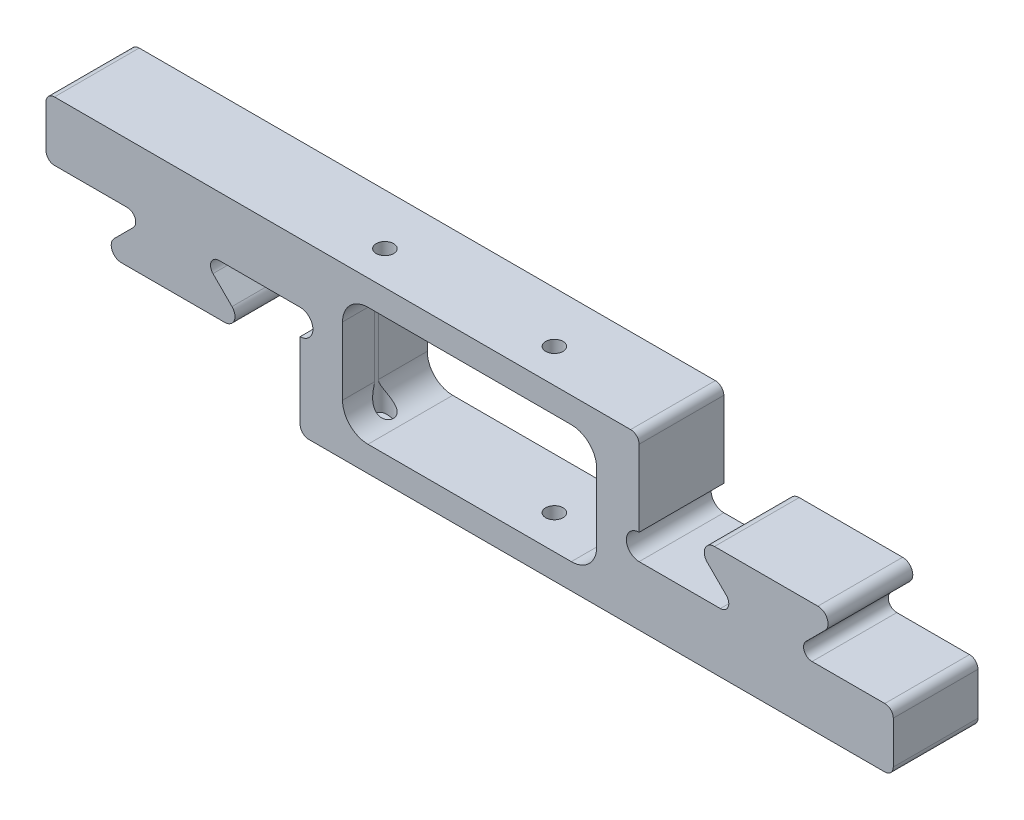
from build123d import *

# Parameters (mm, degrees)
ABS_ZWING_MIRRORED_START      = -10
ABS_ZWING_MIRRORED_DEPTH      = 10
ABS_ZWING_MIRRORED_START_2    = -1.5
ABS_ZWING_MIRRORED_2_DEPTH    = 1.5
SKETCH1_W                     = 30
SKETCH1_H                     = 14
CUT_EXTRUDE1_DEPTH            = 10
FILLET1_R                     = 3
BOSS_EXTRUDE2_DEPTH           = 8.5
CUT_EXTRUDE2_DEPTH            = 10
TAP_DRILL_FOR_M2_5_TAP1_D     = 2.05
TAP_DRILL_FOR_M2_5_TAP1_DEPTH = 30.5


# Read off the part's stored shape, not the designer's step: abs_zwing_Mirrored
with BuildPart() as part:
    # abs_zwing_Mirrored outline → abs_zwing_Mirrored (new body)
    with BuildSketch(Plane.XY.offset(ABS_ZWING_MIRRORED_START)):
        with BuildLine():
            ThreePointArc((-23.5, 2.5), (-22, 1), (-23.5, -0.5))
            Line((-23.5, -0.5), (-23.5, -9.5))
            ThreePointArc((-23.5, -9.5), (-23.207106781, -10.207106781), (-22.5, -10.5))
            Line((-22.5, -10.5), (45.5, -10.5))
            ThreePointArc((45.5, -10.5), (46.207106781, -10.207106781), (46.5, -9.5))
            Line((46.5, -9.5), (46.5, -4.5))
            ThreePointArc((46.5, -4.5), (46.207106781, -3.792893219), (45.5, -3.5))
            Line((45.5, -3.5), (36.914213562, -3.5))
            ThreePointArc((36.914213562, -3.5), (35.99033403, -2.882683432), (36.207106781, -1.792893219))
            Line((36.207106781, -1.792893219), (38.792893219, 0.792893219))
            ThreePointArc((38.792893219, 0.792893219), (39.00966597, 1.882683432), (38.085786438, 2.5))
            Line((38.085786438, 2.5), (24.914213562, 2.5))
            ThreePointArc((24.914213562, 2.5), (23.99033403, 1.882683432), (24.207106781, 0.792893219))
            Line((24.207106781, 0.792893219), (26.792893219, -1.792893219))
            ThreePointArc((26.792893219, -1.792893219), (27.00966597, -2.882683432), (26.085786438, -3.5))
            Line((26.085786438, -3.5), (16.5, -3.5))
            ThreePointArc((16.5, -3.5), (15, -2), (16.5, -0.5))
            Line((16.5, -0.5), (16.5, 8.5))
            ThreePointArc((16.5, 8.5), (16.207106781, 9.207106781), (15.5, 9.5))
            Line((15.5, 9.5), (-52.5, 9.5))
            ThreePointArc((-52.5, 9.5), (-53.207106781, 9.207106781), (-53.5, 8.5))
            Line((-53.5, 8.5), (-53.5, 3.5))
            ThreePointArc((-53.5, 3.5), (-53.207106781, 2.792893219), (-52.5, 2.5))
            Line((-52.5, 2.5), (-43.914213562, 2.5))
            ThreePointArc((-43.914213562, 2.5), (-42.99033403, 1.882683432), (-43.207106781, 0.792893219))
            Line((-43.207106781, 0.792893219), (-45.792893219, -1.792893219))
            ThreePointArc((-45.792893219, -1.792893219), (-46.00966597, -2.882683432), (-45.085786438, -3.5))
            Line((-45.085786438, -3.5), (-31.914213562, -3.5))
            ThreePointArc((-31.914213562, -3.5), (-30.99033403, -2.882683432), (-31.207106781, -1.792893219))
            Line((-31.207106781, -1.792893219), (-33.792893219, 0.792893219))
            ThreePointArc((-33.792893219, 0.792893219), (-34.00966597, 1.882683432), (-33.085786438, 2.5))
            Line((-33.085786438, 2.5), (-23.5, 2.5))
        make_face()
        with BuildLine():
            ThreePointArc((-22, -1.598076211), (-20.602222521, 1.776457136), (-23.5, 4))
            Line((-23.5, 4), (-33.085786438, 4))
            ThreePointArc((-33.085786438, 4), (-35.395485269, 2.456708581), (-34.853553391, -0.267766953))
            Line((-34.853553391, -0.267766953), (-33.121320344, -2))
            Line((-33.121320344, -2), (-43.878679656, -2))
            Line((-43.878679656, -2), (-42.146446609, -0.267766953))
            ThreePointArc((-42.146446609, -0.267766953), (-41.604514731, 2.456708581), (-43.914213562, 4))
            Line((-43.914213562, 4), (-52, 4))
            Line((-52, 4), (-52, 8))
            Line((-52, 8), (15, 8))
            Line((15, 8), (15, 0.598076211))
            ThreePointArc((15, 0.598076211), (13.602222521, -2.776457136), (16.5, -5))
            Line((16.5, -5), (26.085786438, -5))
            ThreePointArc((26.085786438, -5), (28.395485269, -3.456708581), (27.853553391, -0.732233047))
            Line((27.853553391, -0.732233047), (26.121320344, 1))
            Line((26.121320344, 1), (36.878679656, 1))
            Line((36.878679656, 1), (35.146446609, -0.732233047))
            ThreePointArc((35.146446609, -0.732233047), (34.604514731, -3.456708581), (36.914213562, -5))
            Line((36.914213562, -5), (45, -5))
            Line((45, -5), (45, -9))
            Line((45, -9), (-22, -9))
            Line((-22, -9), (-22, -1.598076211))
        make_face(mode=Mode.SUBTRACT)
    extrude(amount=ABS_ZWING_MIRRORED_DEPTH)

    # abs_zwing_Mirrored 2 outline → abs_zwing_Mirrored 2 (add)
    with BuildSketch(Plane.XY.offset(ABS_ZWING_MIRRORED_START_2)):
        with BuildLine():
            Line((-33.085786438, 4), (-23.5, 4))
            ThreePointArc((-23.5, 4), (-20.602222521, 1.776457136), (-22, -1.598076211))
            Line((-22, -1.598076211), (-22, -9))
            Line((-22, -9), (45, -9))
            Line((45, -9), (45, -5))
            Line((45, -5), (36.914213562, -5))
            ThreePointArc((36.914213562, -5), (34.604514731, -3.456708581), (35.146446609, -0.732233047))
            Line((35.146446609, -0.732233047), (36.878679656, 1))
            Line((36.878679656, 1), (26.121320344, 1))
            Line((26.121320344, 1), (27.853553391, -0.732233047))
            ThreePointArc((27.853553391, -0.732233047), (28.395485269, -3.456708581), (26.085786438, -5))
            Line((26.085786438, -5), (16.5, -5))
            ThreePointArc((16.5, -5), (13.602222521, -2.776457136), (15, 0.598076211))
            Line((15, 0.598076211), (15, 8))
            Line((15, 8), (-52, 8))
            Line((-52, 8), (-52, 4))
            Line((-52, 4), (-43.914213562, 4))
            ThreePointArc((-43.914213562, 4), (-41.604514731, 2.456708581), (-42.146446609, -0.267766953))
            Line((-42.146446609, -0.267766953), (-43.878679656, -2))
            Line((-43.878679656, -2), (-33.121320344, -2))
            Line((-33.121320344, -2), (-34.853553391, -0.267766953))
            ThreePointArc((-34.853553391, -0.267766953), (-35.395485269, 2.456708581), (-33.085786438, 4))
        make_face()
    extrude(amount=ABS_ZWING_MIRRORED_2_DEPTH)

    # Sketch1 → Cut-Extrude1 (cut)
    with BuildSketch(Plane(origin=(0, 0, -1.5), x_dir=(-1, 0, 0), z_dir=(0, 0, -1))):
        with Locations((3.5, -0.5)):
            Rectangle(SKETCH1_W, SKETCH1_H)
    extrude(amount=-CUT_EXTRUDE1_DEPTH, mode=Mode.SUBTRACT)

    # Fillet1
    fillet1_edges = [part.edges().sort_by_distance(p)[0] for p in [
        (11.5, -7.5, -0.75),
        (11.5, 6.5, -0.75),
        (-18.5, 6.5, -0.75),
        (-18.5, -7.5, -0.75),
    ]]
    fillet(fillet1_edges, radius=FILLET1_R)

    # Sketch4 → Boss-Extrude2 (add)
    with BuildSketch(Plane(origin=(0, 0, -1.5), x_dir=(-1, 0, 0), z_dir=(0, 0, -1))):
        with BuildLine():
            Line((-13, 3.5), (-13, -4.5))
            ThreePointArc((-13, -4.5), (-11.681980515, -7.681980515), (-8.5, -9))
            Line((-8.5, -9), (15.5, -9))
            ThreePointArc((15.5, -9), (18.681980515, -7.681980515), (20, -4.5))
            Line((20, -4.5), (20, 3.5))
            ThreePointArc((20, 3.5), (18.681980515, 6.681980515), (15.5, 8))
            Line((15.5, 8), (-8.5, 8))
            ThreePointArc((-8.5, 8), (-11.681980515, 6.681980515), (-13, 3.5))
        make_face()
        with BuildLine():
            Line((-11.5, 3.5), (-11.5, -4.5))
            ThreePointArc((-11.5, -4.5), (-10.621320344, -6.621320344), (-8.5, -7.5))
            Line((-8.5, -7.5), (15.5, -7.5))
            ThreePointArc((15.5, -7.5), (17.621320344, -6.621320344), (18.5, -4.5))
            Line((18.5, -4.5), (18.5, 3.5))
            ThreePointArc((18.5, 3.5), (17.621320344, 5.621320344), (15.5, 6.5))
            Line((15.5, 6.5), (-8.5, 6.5))
            ThreePointArc((-8.5, 6.5), (-10.621320344, 5.621320344), (-11.5, 3.5))
        make_face(mode=Mode.SUBTRACT)
    extrude(amount=BOSS_EXTRUDE2_DEPTH)

    # Sketch8 → Cut-Extrude2 (cut)
    with BuildSketch(Plane(origin=(0, 0, -10), x_dir=(-1, 0, 0), z_dir=(0, 0, -1))):
        with BuildLine():
            Line((-38.451471863, 0.451471863), (-40.5, 2.5))
            Line((-40.5, 2.5), (-37.602943725, 2.5))
            ThreePointArc((-37.602943725, 2.5), (-38.711599164, 1.759220119), (-38.451471863, 0.451471863))
        make_face()
        with BuildLine():
            Line((-25.397056275, 2.5), (-22.5, 2.5))
            Line((-22.5, 2.5), (-24.548528137, 0.451471863))
            ThreePointArc((-24.548528137, 0.451471863), (-24.288400836, 1.759220119), (-25.397056275, 2.5))
        make_face()
        with BuildLine():
            Line((33, 0), (31.548528137, -1.451471863))
            ThreePointArc((31.548528137, -1.451471863), (31.288400836, -2.759220119), (32.397056275, -3.5))
            Line((32.397056275, -3.5), (44.602943725, -3.5))
            ThreePointArc((44.602943725, -3.5), (45.711599164, -2.759220119), (45.451471863, -1.451471863))
            Line((45.451471863, -1.451471863), (44.329289322, -0.329289322))
            Line((44.329289322, -0.329289322), (49.897345602, -0.329289322))
            Line((49.897345602, -0.329289322), (49.897345602, -5.77544861))
            Line((49.897345602, -5.77544861), (28.682020132, -5.77544861))
            Line((28.682020132, -5.77544861), (28.682020132, 0))
            Line((28.682020132, 0), (33, 0))
        make_face()
    extrude(amount=-CUT_EXTRUDE2_DEPTH, mode=Mode.SUBTRACT)

    # Tap Drill for M2.5 Tap1
    with Locations(Plane.XZ.offset(10.5)):
        with Locations((-17.5, -4), (2.5, -4)):
            Hole(TAP_DRILL_FOR_M2_5_TAP1_D / 2, depth=TAP_DRILL_FOR_M2_5_TAP1_DEPTH)


solid = part.part
